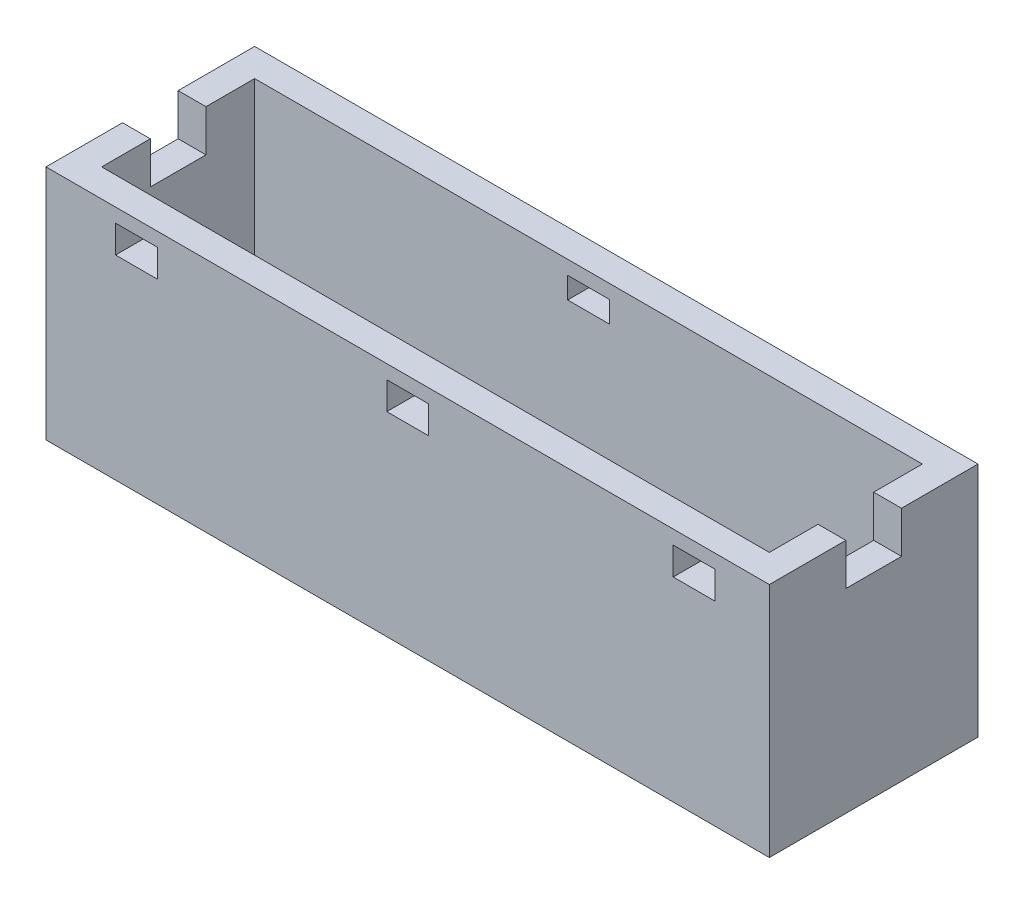
from build123d import *

# Parameters (mm, degrees)
SKETCH_1_W           = 520
SKETCH_1_H           = 150
EXTRUDE_1_DEPTH      = 140
SKETCH_2_W           = 480
SKETCH_2_H           = 110
CUT_EXTRUDE_1_DEPTH  = 120
SKETCH_11_W          = 40
SKETCH_11_H          = 30
CUT_EXTRUDE_3_DEPTH  = 544.714079273
SKETCH_13_W          = 520
SKETCH_13_H          = 150
EXTRUDE_6_DEPTH      = 30
SKETCH_18_W          = 30
SKETCH_18_H          = 15.352958973
CUT_EXTRUDE_8_DEPTH  = 30
FILLET_1_R           = 10
SKETCH_21_W          = 30
SKETCH_21_H          = 19.875616275
CUT_EXTRUDE_9_DEPTH  = 30
SKETCH_22_W          = 30
SKETCH_22_H          = 19.88
CUT_EXTRUDE_10_DEPTH = 30
SKETCH_25_W          = 30
SKETCH_25_H          = 19.88
CUT_EXTRUDE_12_DEPTH = 30


with BuildPart() as part:
    # 草圖1 → 填料-伸長1 (new body)
    with BuildSketch(Plane(origin=(0, 0, 0), x_dir=(1, 0, 0), z_dir=(0, 1, 0))):
        Rectangle(SKETCH_1_W, SKETCH_1_H)
    extrude(amount=EXTRUDE_1_DEPTH)

    # 草圖2 → 除料-伸長1 (cut)
    with BuildSketch(Plane(origin=(0, 140, 0), x_dir=(1, 0, 0), z_dir=(0, 1, 0))):
        Rectangle(SKETCH_2_W, SKETCH_2_H)
    extrude(amount=-CUT_EXTRUDE_1_DEPTH, mode=Mode.SUBTRACT)

    # 草圖11 → 除料-伸長3 (cut, through all)
    with BuildSketch(Plane.ZY.offset(260)):
        with Locations((0, 125)):
            Rectangle(SKETCH_11_W, SKETCH_11_H)
    extrude(amount=-CUT_EXTRUDE_3_DEPTH, mode=Mode.SUBTRACT)

    # 草圖13 → 填料-伸長6 (add)
    with BuildSketch(Plane.XZ):
        Rectangle(SKETCH_13_W, SKETCH_13_H)
    extrude(amount=EXTRUDE_6_DEPTH)

    # 草圖18 → 除料-伸長8 (cut)
    with BuildSketch(Plane(origin=(0, 0, -75), x_dir=(-1, 0, 0), z_dir=(0, 0, -1))):
        with Locations((0, 122.323520514)):
            Rectangle(SKETCH_18_W, SKETCH_18_H)
    extrude(amount=-CUT_EXTRUDE_8_DEPTH, mode=Mode.SUBTRACT)

    # 圓角1
    fillet_1_edges = [part.edges().sort_by_distance(p)[0] for p in [
        (0, 130, -75),
    ]]
    fillet(fillet_1_edges, radius=FILLET_1_R - 0.0001)  # a hair under: the kernel refuses the full size

    # 草圖21 → 除料-伸長9 (cut)
    with BuildSketch(Plane.XY.offset(75)):
        with Locations((-195, 120.062191863)):
            Rectangle(SKETCH_21_W, SKETCH_21_H)
    extrude(amount=-CUT_EXTRUDE_9_DEPTH, mode=Mode.SUBTRACT)

    # 草圖22 → 除料-伸長10 (cut)
    with BuildSketch(Plane.XY.offset(75)):
        with Locations((0, 120.06)):
            Rectangle(SKETCH_22_W, SKETCH_22_H)
    extrude(amount=-CUT_EXTRUDE_10_DEPTH, mode=Mode.SUBTRACT)

    # 草圖25 → 除料-伸長12 (cut)
    with BuildSketch(Plane.XY.offset(75)):
        with Locations((205.891066665, 120.06)):
            Rectangle(SKETCH_25_W, SKETCH_25_H)
    extrude(amount=-CUT_EXTRUDE_12_DEPTH, mode=Mode.SUBTRACT)


solid = part.part
